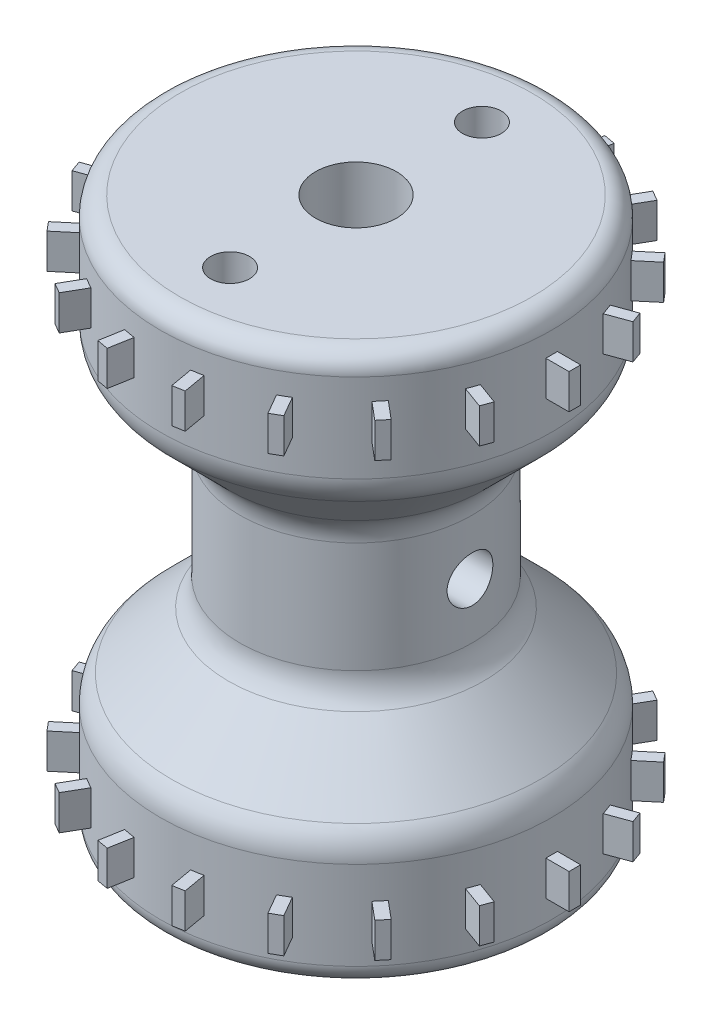
from build123d import *

# Parameters (mm, degrees)
SKETCH1_R                 = 12.827
BOSS_EXTRUDE1_DEPTH       = 36
F_5_0MM_DOWEL_HOLE1_D     = 5.3
BOSS_EXTRUDE2_START       = -4.953
BOSS_EXTRUDE2_DEPTH       = 2.286
CIRPATTERN3_COUNT         = 18
CIRPATTERN3_START         = -4.953
CIRPATTERN3_COPY_1_DEPTH  = 2.286
CIRPATTERN3_COPY_2_DEPTH  = 2.286
CIRPATTERN3_COPY_3_DEPTH  = 2.286
CIRPATTERN3_COPY_4_DEPTH  = 2.286
CIRPATTERN3_COPY_5_DEPTH  = 2.286
CIRPATTERN3_COPY_6_DEPTH  = 2.286
CIRPATTERN3_COPY_7_DEPTH  = 2.286
CIRPATTERN3_COPY_8_DEPTH  = 2.286
CIRPATTERN3_COPY_9_DEPTH  = 2.286
CIRPATTERN3_COPY_10_DEPTH = 2.286
CIRPATTERN3_COPY_11_DEPTH = 2.286
CIRPATTERN3_COPY_12_DEPTH = 2.286
CIRPATTERN3_COPY_13_DEPTH = 2.286
CIRPATTERN3_COPY_14_DEPTH = 2.286
CIRPATTERN3_COPY_15_DEPTH = 2.286
CIRPATTERN3_COPY_16_DEPTH = 2.286
CIRPATTERN3_COPY_17_DEPTH = 2.286
SKETCH7_W                 = 5.207
SKETCH7_H                 = 20.76
CHAMFER1_SIZE             = 5.700888889
FILLET1_R                 = 2.54
FILLET3_R                 = 2.54
SKETCH10_W                = 1.5
SKETCH10_H                = 14.345340336
FILLET2_R                 = 1.27
M3X0_5_TAPPED_HOLE2_D     = 2.55
M3X0_5_TAPPED_HOLE2_DEPTH = 9.906
M3X0_5_TAPPED_HOLE2_TIP   = 1.06985203
M3X0_5_TAPPED_HOLE1_D     = 2.5
M3X0_5_TAPPED_HOLE1_DEPTH = 9.906
M3X0_5_TAPPED_HOLE1_TIP   = 1.048874539


with BuildPart() as part:
    # Sketch1 → Boss-Extrude1 (new body)
    with BuildSketch(Plane(origin=(0, 0, 0), x_dir=(1, 0, 0), z_dir=(0, 1, 0))):
        with Locations(Location((0, 0, 0), (0, 0, 270))):
            Circle(SKETCH1_R)
    extrude(amount=BOSS_EXTRUDE1_DEPTH)

    # Ø5.0mm Dowel Hole1 (through all)
    with Locations(Plane(origin=(0, 36, 0), x_dir=(1, 0, 0), z_dir=(0, 1, 0))):
        with Locations((0, 0)):
            Hole(F_5_0MM_DOWEL_HOLE1_D / 2)

    # Sketch4 → Boss-Extrude2 (add)
    with BuildSketch(Plane(origin=(0, 36, 0), x_dir=(1, 0, 0), z_dir=(0, 1, 0)).offset(BOSS_EXTRUDE2_START)):
        with BuildLine():
            Line((14.345340336, 0.381), (12.821340336, 0.381))
            ThreePointArc((12.821340336, 0.381), (12.825585006, 0.190521017), (12.827, 0))
            ThreePointArc((12.827, 0), (12.825585006, -0.190521017), (12.821340336, -0.381))
            Line((12.821340336, -0.381), (14.345340336, -0.381))
            Line((14.345340336, -0.381), (14.345340336, 0.381))
        make_face()
    boss_extrude2 = extrude(amount=BOSS_EXTRUDE2_DEPTH)

    # Mirror4: Boss-Extrude2 across plane
    add(boss_extrude2.mirror(Plane.ZX.offset(18)))

    # CirPattern3: Boss-Extrude2 ×18 about axis
    cirpattern3_axis = Axis((0, 0, 0), (0, 1, 0))
    for i in range(1, CIRPATTERN3_COUNT):
        add(boss_extrude2.rotate(cirpattern3_axis, i * 360 / CIRPATTERN3_COUNT))

    # CirPattern3 copy 1 sketch → CirPattern3 copy 1 (add)
    with BuildSketch(Plane(origin=(0, 0, 0), x_dir=(0.9396926207859084, 0, -0.3420201433256687), z_dir=(0, -1, 0)).offset(CIRPATTERN3_START)):
        with BuildLine():
            Line((14.345340336, -0.381), (12.821340336, -0.381))
            ThreePointArc((12.821340336, -0.381), (12.825585006, -0.190521017), (12.827, 0))
            ThreePointArc((12.827, 0), (12.825585006, 0.190521017), (12.821340336, 0.381))
            Line((12.821340336, 0.381), (14.345340336, 0.381))
            Line((14.345340336, 0.381), (14.345340336, -0.381))
        make_face()
    extrude(amount=CIRPATTERN3_COPY_1_DEPTH)

    # CirPattern3 copy 2 sketch → CirPattern3 copy 2 (add)
    with BuildSketch(Plane(origin=(0, 0, 0), x_dir=(0.766044443118978, 0, -0.6427876096865393), z_dir=(0, -1, 0)).offset(CIRPATTERN3_START)):
        with BuildLine():
            Line((14.345340336, -0.381), (12.821340336, -0.381))
            ThreePointArc((12.821340336, -0.381), (12.825585006, -0.190521017), (12.827, 0))
            ThreePointArc((12.827, 0), (12.825585006, 0.190521017), (12.821340336, 0.381))
            Line((12.821340336, 0.381), (14.345340336, 0.381))
            Line((14.345340336, 0.381), (14.345340336, -0.381))
        make_face()
    extrude(amount=CIRPATTERN3_COPY_2_DEPTH)

    # CirPattern3 copy 3 sketch → CirPattern3 copy 3 (add)
    with BuildSketch(Plane(origin=(0, 0, 0), x_dir=(0.5000000000000001, 0, -0.8660254037844386), z_dir=(0, -1, 0)).offset(CIRPATTERN3_START)):
        with BuildLine():
            Line((14.345340336, -0.381), (12.821340336, -0.381))
            ThreePointArc((12.821340336, -0.381), (12.825585006, -0.190521017), (12.827, 0))
            ThreePointArc((12.827, 0), (12.825585006, 0.190521017), (12.821340336, 0.381))
            Line((12.821340336, 0.381), (14.345340336, 0.381))
            Line((14.345340336, 0.381), (14.345340336, -0.381))
        make_face()
    extrude(amount=CIRPATTERN3_COPY_3_DEPTH)

    # CirPattern3 copy 4 sketch → CirPattern3 copy 4 (add)
    with BuildSketch(Plane(origin=(0, 0, 0), x_dir=(0.17364817766693041, 0, -0.984807753012208), z_dir=(0, -1, 0)).offset(CIRPATTERN3_START)):
        with BuildLine():
            Line((14.345340336, -0.381), (12.821340336, -0.381))
            ThreePointArc((12.821340336, -0.381), (12.825585006, -0.190521017), (12.827, 0))
            ThreePointArc((12.827, 0), (12.825585006, 0.190521017), (12.821340336, 0.381))
            Line((12.821340336, 0.381), (14.345340336, 0.381))
            Line((14.345340336, 0.381), (14.345340336, -0.381))
        make_face()
    extrude(amount=CIRPATTERN3_COPY_4_DEPTH)

    # CirPattern3 copy 5 sketch → CirPattern3 copy 5 (add)
    with BuildSketch(Plane(origin=(0, 0, 0), x_dir=(-0.1736481776669303, 0, -0.984807753012208), z_dir=(0, -1, 0)).offset(CIRPATTERN3_START)):
        with BuildLine():
            Line((14.345340336, -0.381), (12.821340336, -0.381))
            ThreePointArc((12.821340336, -0.381), (12.825585006, -0.190521017), (12.827, 0))
            ThreePointArc((12.827, 0), (12.825585006, 0.190521017), (12.821340336, 0.381))
            Line((12.821340336, 0.381), (14.345340336, 0.381))
            Line((14.345340336, 0.381), (14.345340336, -0.381))
        make_face()
    extrude(amount=CIRPATTERN3_COPY_5_DEPTH)

    # CirPattern3 copy 6 sketch → CirPattern3 copy 6 (add)
    with BuildSketch(Plane(origin=(0, 0, 0), x_dir=(-0.4999999999999998, 0, -0.8660254037844387), z_dir=(0, -1, 0)).offset(CIRPATTERN3_START)):
        with BuildLine():
            Line((14.345340336, -0.381), (12.821340336, -0.381))
            ThreePointArc((12.821340336, -0.381), (12.825585006, -0.190521017), (12.827, 0))
            ThreePointArc((12.827, 0), (12.825585006, 0.190521017), (12.821340336, 0.381))
            Line((12.821340336, 0.381), (14.345340336, 0.381))
            Line((14.345340336, 0.381), (14.345340336, -0.381))
        make_face()
    extrude(amount=CIRPATTERN3_COPY_6_DEPTH)

    # CirPattern3 copy 7 sketch → CirPattern3 copy 7 (add)
    with BuildSketch(Plane(origin=(0, 0, 0), x_dir=(-0.7660444431189779, 0, -0.6427876096865395), z_dir=(0, -1, 0)).offset(CIRPATTERN3_START)):
        with BuildLine():
            Line((14.345340336, -0.381), (12.821340336, -0.381))
            ThreePointArc((12.821340336, -0.381), (12.825585006, -0.190521017), (12.827, 0))
            ThreePointArc((12.827, 0), (12.825585006, 0.190521017), (12.821340336, 0.381))
            Line((12.821340336, 0.381), (14.345340336, 0.381))
            Line((14.345340336, 0.381), (14.345340336, -0.381))
        make_face()
    extrude(amount=CIRPATTERN3_COPY_7_DEPTH)

    # CirPattern3 copy 8 sketch → CirPattern3 copy 8 (add)
    with BuildSketch(Plane(origin=(0, 0, 0), x_dir=(-0.9396926207859083, 0, -0.3420201433256689), z_dir=(0, -1, 0)).offset(CIRPATTERN3_START)):
        with BuildLine():
            Line((14.345340336, -0.381), (12.821340336, -0.381))
            ThreePointArc((12.821340336, -0.381), (12.825585006, -0.190521017), (12.827, 0))
            ThreePointArc((12.827, 0), (12.825585006, 0.190521017), (12.821340336, 0.381))
            Line((12.821340336, 0.381), (14.345340336, 0.381))
            Line((14.345340336, 0.381), (14.345340336, -0.381))
        make_face()
    extrude(amount=CIRPATTERN3_COPY_8_DEPTH)

    # CirPattern3 copy 9 sketch → CirPattern3 copy 9 (add)
    with BuildSketch(Plane(origin=(0, 0, 0), x_dir=(-1, 0, 0), z_dir=(0, -1, 0)).offset(CIRPATTERN3_START)):
        with BuildLine():
            Line((14.345340336, -0.381), (12.821340336, -0.381))
            ThreePointArc((12.821340336, -0.381), (12.825585006, -0.190521017), (12.827, 0))
            ThreePointArc((12.827, 0), (12.825585006, 0.190521017), (12.821340336, 0.381))
            Line((12.821340336, 0.381), (14.345340336, 0.381))
            Line((14.345340336, 0.381), (14.345340336, -0.381))
        make_face()
    extrude(amount=CIRPATTERN3_COPY_9_DEPTH)

    # CirPattern3 copy 10 sketch → CirPattern3 copy 10 (add)
    with BuildSketch(Plane(origin=(0, 0, 0), x_dir=(-0.9396926207859084, 0, 0.34202014332566866), z_dir=(0, -1, 0)).offset(CIRPATTERN3_START)):
        with BuildLine():
            Line((14.345340336, -0.381), (12.821340336, -0.381))
            ThreePointArc((12.821340336, -0.381), (12.825585006, -0.190521017), (12.827, 0))
            ThreePointArc((12.827, 0), (12.825585006, 0.190521017), (12.821340336, 0.381))
            Line((12.821340336, 0.381), (14.345340336, 0.381))
            Line((14.345340336, 0.381), (14.345340336, -0.381))
        make_face()
    extrude(amount=CIRPATTERN3_COPY_10_DEPTH)

    # CirPattern3 copy 11 sketch → CirPattern3 copy 11 (add)
    with BuildSketch(Plane(origin=(0, 0, 0), x_dir=(-0.766044443118978, 0, 0.6427876096865393), z_dir=(0, -1, 0)).offset(CIRPATTERN3_START)):
        with BuildLine():
            Line((14.345340336, -0.381), (12.821340336, -0.381))
            ThreePointArc((12.821340336, -0.381), (12.825585006, -0.190521017), (12.827, 0))
            ThreePointArc((12.827, 0), (12.825585006, 0.190521017), (12.821340336, 0.381))
            Line((12.821340336, 0.381), (14.345340336, 0.381))
            Line((14.345340336, 0.381), (14.345340336, -0.381))
        make_face()
    extrude(amount=CIRPATTERN3_COPY_11_DEPTH)

    # CirPattern3 copy 12 sketch → CirPattern3 copy 12 (add)
    with BuildSketch(Plane(origin=(0, 0, 0), x_dir=(-0.5000000000000004, 0, 0.8660254037844384), z_dir=(0, -1, 0)).offset(CIRPATTERN3_START)):
        with BuildLine():
            Line((14.345340336, -0.381), (12.821340336, -0.381))
            ThreePointArc((12.821340336, -0.381), (12.825585006, -0.190521017), (12.827, 0))
            ThreePointArc((12.827, 0), (12.825585006, 0.190521017), (12.821340336, 0.381))
            Line((12.821340336, 0.381), (14.345340336, 0.381))
            Line((14.345340336, 0.381), (14.345340336, -0.381))
        make_face()
    extrude(amount=CIRPATTERN3_COPY_12_DEPTH)

    # CirPattern3 copy 13 sketch → CirPattern3 copy 13 (add)
    with BuildSketch(Plane(origin=(0, 0, 0), x_dir=(-0.17364817766693033, 0, 0.984807753012208), z_dir=(0, -1, 0)).offset(CIRPATTERN3_START)):
        with BuildLine():
            Line((14.345340336, -0.381), (12.821340336, -0.381))
            ThreePointArc((12.821340336, -0.381), (12.825585006, -0.190521017), (12.827, 0))
            ThreePointArc((12.827, 0), (12.825585006, 0.190521017), (12.821340336, 0.381))
            Line((12.821340336, 0.381), (14.345340336, 0.381))
            Line((14.345340336, 0.381), (14.345340336, -0.381))
        make_face()
    extrude(amount=CIRPATTERN3_COPY_13_DEPTH)

    # CirPattern3 copy 14 sketch → CirPattern3 copy 14 (add)
    with BuildSketch(Plane(origin=(0, 0, 0), x_dir=(0.17364817766692997, 0, 0.9848077530122081), z_dir=(0, -1, 0)).offset(CIRPATTERN3_START)):
        with BuildLine():
            Line((14.345340336, -0.381), (12.821340336, -0.381))
            ThreePointArc((12.821340336, -0.381), (12.825585006, -0.190521017), (12.827, 0))
            ThreePointArc((12.827, 0), (12.825585006, 0.190521017), (12.821340336, 0.381))
            Line((12.821340336, 0.381), (14.345340336, 0.381))
            Line((14.345340336, 0.381), (14.345340336, -0.381))
        make_face()
    extrude(amount=CIRPATTERN3_COPY_14_DEPTH)

    # CirPattern3 copy 15 sketch → CirPattern3 copy 15 (add)
    with BuildSketch(Plane(origin=(0, 0, 0), x_dir=(0.5000000000000001, 0, 0.8660254037844386), z_dir=(0, -1, 0)).offset(CIRPATTERN3_START)):
        with BuildLine():
            Line((14.345340336, -0.381), (12.821340336, -0.381))
            ThreePointArc((12.821340336, -0.381), (12.825585006, -0.190521017), (12.827, 0))
            ThreePointArc((12.827, 0), (12.825585006, 0.190521017), (12.821340336, 0.381))
            Line((12.821340336, 0.381), (14.345340336, 0.381))
            Line((14.345340336, 0.381), (14.345340336, -0.381))
        make_face()
    extrude(amount=CIRPATTERN3_COPY_15_DEPTH)

    # CirPattern3 copy 16 sketch → CirPattern3 copy 16 (add)
    with BuildSketch(Plane(origin=(0, 0, 0), x_dir=(0.7660444431189778, 0, 0.6427876096865396), z_dir=(0, -1, 0)).offset(CIRPATTERN3_START)):
        with BuildLine():
            Line((14.345340336, -0.381), (12.821340336, -0.381))
            ThreePointArc((12.821340336, -0.381), (12.825585006, -0.190521017), (12.827, 0))
            ThreePointArc((12.827, 0), (12.825585006, 0.190521017), (12.821340336, 0.381))
            Line((12.821340336, 0.381), (14.345340336, 0.381))
            Line((14.345340336, 0.381), (14.345340336, -0.381))
        make_face()
    extrude(amount=CIRPATTERN3_COPY_16_DEPTH)

    # CirPattern3 copy 17 sketch → CirPattern3 copy 17 (add)
    with BuildSketch(Plane(origin=(0, 0, 0), x_dir=(0.9396926207859084, 0, 0.3420201433256686), z_dir=(0, -1, 0)).offset(CIRPATTERN3_START)):
        with BuildLine():
            Line((14.345340336, -0.381), (12.821340336, -0.381))
            ThreePointArc((12.821340336, -0.381), (12.825585006, -0.190521017), (12.827, 0))
            ThreePointArc((12.827, 0), (12.825585006, 0.190521017), (12.821340336, 0.381))
            Line((12.821340336, 0.381), (14.345340336, 0.381))
            Line((14.345340336, 0.381), (14.345340336, -0.381))
        make_face()
    extrude(amount=CIRPATTERN3_COPY_17_DEPTH)

    # Sketch7 → Cut-Revolve1 (revolve, cut)
    with BuildSketch(Plane(origin=(0, 0, 0), x_dir=(0, 0, -1), z_dir=(1, 0, 0)), mode=Mode.PRIVATE) as cut_revolve1_sk:
        with Locations((10.2235, 18)):
            Rectangle(SKETCH7_W, SKETCH7_H)
    revolve(cut_revolve1_sk.sketch.rotate(Axis((0, 36, 0), (0, -1, 0)), 180), axis=Axis((0, 36, 0), (0, -1, 0)), mode=Mode.SUBTRACT)

    # Chamfer1
    # the kernel refuses this chamfer: 5.700888889 mm, written as the material it adds along each edge
    with BuildSketch(Plane(origin=(0, 28.38, 0), x_dir=(0, 0, 1), z_dir=(1, 0, 0))) as chamfer1_piece_1_section:
        Polygon((7.62, CHAMFER1_SIZE), (7.62 + CHAMFER1_SIZE, 0), (7.62, 0), align=None)
    chamfer1_piece_1 = revolve(axis=Axis((0, 28.38, 0), (0, -1, 0)), mode=Mode.PRIVATE)
    chamfer1_piece_1 = chamfer1_piece_1 & Plane(origin=(0, 25.273744899, 0), x_dir=(0, 0, 1), z_dir=(0, -1, 0)) * Cylinder(12.827, 54, mode=Mode.PRIVATE)
    add(chamfer1_piece_1)
    with BuildSketch(Plane(origin=(0, 7.62, 0), x_dir=(0, 0, 1), z_dir=(1, 0, 0))) as chamfer1_piece_2_section:
        Polygon((7.62 + CHAMFER1_SIZE, 0), (7.62, -CHAMFER1_SIZE), (7.62, 0), align=None)
    chamfer1_piece_2 = revolve(axis=Axis((0, 7.62, 0), (0, -1, 0)), mode=Mode.PRIVATE)
    chamfer1_piece_2 = chamfer1_piece_2 & Plane(origin=(0, 10.726255101, 0), x_dir=(0, 0, 1), z_dir=(0, -1, 0)) * Cylinder(12.827, 54, mode=Mode.PRIVATE)
    add(chamfer1_piece_2)

    # Fillet1
    fillet1_edges = [part.edges().sort_by_distance(p)[0] for p in [
        (0, 13.320888889, -7.62),
        (0, 22.679111111, -7.62),
    ]]
    fillet(fillet1_edges, radius=FILLET1_R)

    # Fillet3
    fillet3_edges = [part.edges().sort_by_distance(p)[0] for p in [
        (0, 27.886111111, -12.827),
        (0, 8.113888889, -12.827),
    ]]
    fillet(fillet3_edges, radius=FILLET3_R)

    # Sketch10 → Ø3.0mm Dowel Hole1 (revolve, cut)
    with BuildSketch(Plane.ZX.offset(18)):
        with Locations((0.75, 7.172670168)):
            Rectangle(SKETCH10_W, SKETCH10_H)
    revolve(axis=Axis((-6.35, 18, 0), (1, 0, 0)), mode=Mode.SUBTRACT)

    # Fillet2
    fillet2_edges = [part.edges().sort_by_distance(p)[0] for p in [
        (0, 0, -12.827),
        (0, 36, -12.827),
    ]]
    fillet(fillet2_edges, radius=FILLET2_R)

    # M3x0.5 Tapped Hole2
    with Locations(Plane(origin=(0, 36, 0), x_dir=(1, 0, 0), z_dir=(0, 1, 0))):
        with Locations((0, 8.255), (0, -8.255)):
            Hole(M3X0_5_TAPPED_HOLE2_D / 2, depth=M3X0_5_TAPPED_HOLE2_DEPTH)
            with Locations((0, 0, -(M3X0_5_TAPPED_HOLE2_DEPTH + M3X0_5_TAPPED_HOLE2_TIP / 2))):  # 100° drill point
                Cone(0, M3X0_5_TAPPED_HOLE2_D / 2, M3X0_5_TAPPED_HOLE2_TIP, mode=Mode.SUBTRACT)

    # M3x0.5 Tapped Hole1
    with Locations(Plane(origin=(0, 0, 0), x_dir=(-1, 0, 0), z_dir=(0, -1, 0))):
        with Locations((0, 8.255), (0, -8.255)):
            Hole(M3X0_5_TAPPED_HOLE1_D / 2, depth=M3X0_5_TAPPED_HOLE1_DEPTH)
            with Locations((0, 0, -(M3X0_5_TAPPED_HOLE1_DEPTH + M3X0_5_TAPPED_HOLE1_TIP / 2))):  # 100° drill point
                Cone(0, M3X0_5_TAPPED_HOLE1_D / 2, M3X0_5_TAPPED_HOLE1_TIP, mode=Mode.SUBTRACT)


solid = part.part
